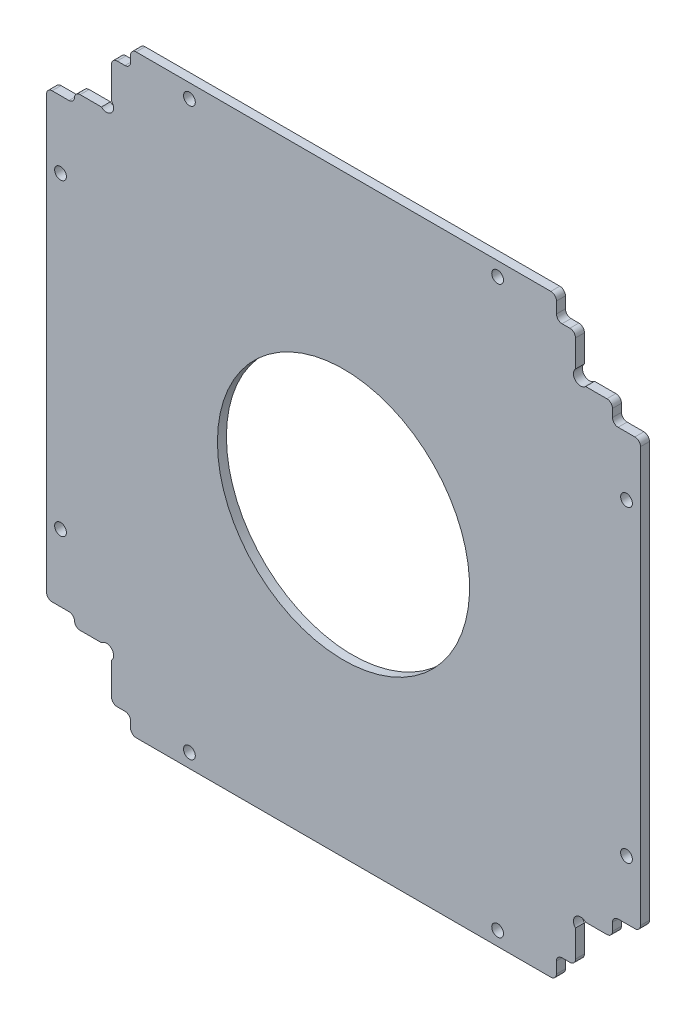
from build123d import *

# Parameters (mm, degrees)
SKETCH1_W               = 106
SKETCH1_H               = 106
MAINOUTLINE_DEPTH       = 1.6
RAILCUTOUTS_DEPTH       = 75.970394157
DOGBONES_DEPTH          = 75.970394157
SOLARFILLETS_DEPTH      = 75.970394157
HANDLINGFILLETS_R       = 1
M2_CLEARANCE_HOLE1_D    = 2.1
CUT_EXTRUDE2_DEPTH      = 75.9703943
CUT_EXTRUDE2_DEPTH_BACK = 75.9703943
SKETCH11_R              = 22.5


with BuildPart() as part:
    # Sketch1 → mainOutline (new body)
    with BuildSketch(Plane.XY):
        Rectangle(SKETCH1_W, SKETCH1_H)
    extrude(amount=MAINOUTLINE_DEPTH)

    # Sketch4 → railCutouts (cut, through all)
    with BuildSketch(Plane(origin=(0, 0, 0), x_dir=(-1, 0, 0), z_dir=(0, 0, -1))):
        Polygon((-41.4, -41.4), (-48, -41.4), (-48, -39), (-49.9975, -39), (-60.106513243, -39), (-60.106513243, -61.452099286), (-39, -61.452099286), (-39, -49.9), (-39, -49), (-41.4, -49), align=None)
        Polygon((39, -56.27525328), (39, -49.9), (41.4, -49.9), (41.4, -41.4), (48, -41.4), (48, -40.5), (55.517672261, -40.5), (55.517672261, -56.27525328), align=None)
        Polygon((55.383846757, 40.5), (48, 40.5), (48, 41.4), (41.4, 41.4), (41.4, 49.9), (39, 49.9), (39, 57.687687567), (55.383846757, 57.687687567), align=None)
        Polygon((-39, 59.880423019), (-39, 49.9), (-39, 49), (-41.4, 49), (-41.4, 41.4), (-48, 41.4), (-48, 39), (-49.9975, 39), (-56.842822937, 39), (-56.842822937, 59.880423019), align=None)
    extrude(amount=-RAILCUTOUTS_DEPTH, mode=Mode.SUBTRACT)

    # Sketch5 → dogbones (cut, through all)
    with BuildSketch(Plane(origin=(0, 0, 0), x_dir=(-1, 0, 0), z_dir=(0, 0, -1))):
        with BuildLine():
            Line((-41.4, -43.196051224), (-44.546497129, -46.342548353))
            ThreePointArc((-44.546497129, -46.342548353), (-46.342548353, -46.342548353), (-46.342548353, -44.546497129))
            Line((-46.342548353, -44.546497129), (-43.196051224, -41.4))
            ThreePointArc((-43.196051224, -41.4), (-41.4, -41.4), (-41.4, -43.196051224))
        make_face()
        with BuildLine():
            Line((43.196051224, -41.4), (44.93821772, -43.142166495))
            ThreePointArc((44.93821772, -43.142166495), (44.93821772, -44.93821772), (43.142166495, -44.93821772))
            Line((43.142166495, -44.93821772), (41.4, -43.196051224))
            ThreePointArc((41.4, -43.196051224), (41.4, -41.4), (43.196051224, -41.4))
        make_face()
        with BuildLine():
            Line((41.4, 43.196051224), (43.13099025, 44.927041474))
            ThreePointArc((43.13099025, 44.927041474), (44.927041474, 44.927041474), (44.927041474, 43.13099025))
            Line((44.927041474, 43.13099025), (43.196051224, 41.4))
            ThreePointArc((43.196051224, 41.4), (41.4, 41.4), (41.4, 43.196051224))
        make_face()
        with BuildLine():
            Line((-43.196051224, 41.4), (-44.694846249, 42.898795025))
            ThreePointArc((-44.694846249, 42.898795025), (-44.694846249, 44.694846249), (-42.898795025, 44.694846249))
            Line((-42.898795025, 44.694846249), (-41.4, 43.196051224))
            ThreePointArc((-41.4, 43.196051224), (-41.4, 41.4), (-43.196051224, 41.4))
        make_face()
    extrude(amount=-DOGBONES_DEPTH, mode=Mode.SUBTRACT)

    # Sketch6 → solarFillets (cut, through all)
    with BuildSketch(Plane(origin=(0, 0, 0), x_dir=(-1, 0, 0), z_dir=(0, 0, -1))):
        with BuildLine():
            Line((-40, 50), (-40, 53))
            ThreePointArc((-40, 53), (-39, 54), (-38, 53))
            Line((-38, 53), (-38, 50))
            ThreePointArc((-38, 50), (-39, 49), (-40, 50))
        make_face()
        with BuildLine():
            Line((-49, 38), (-53, 38))
            ThreePointArc((-53, 38), (-54, 39), (-53, 40))
            Line((-53, 40), (-49, 40))
            ThreePointArc((-49, 40), (-48, 39), (-49, 38))
        make_face()
        with BuildLine():
            Line((-49, -40), (-55.214202913, -40))
            ThreePointArc((-55.214202913, -40), (-56.214202913, -39), (-55.214202913, -38))
            Line((-55.214202913, -38), (-49, -38))
            ThreePointArc((-49, -38), (-48, -39), (-49, -40))
        make_face()
        with BuildLine():
            Line((-38, -50), (-38, -53.916094318))
            ThreePointArc((-38, -53.916094318), (-39, -54.916094318), (-40, -53.916094318))
            Line((-40, -53.916094318), (-40, -50))
            ThreePointArc((-40, -50), (-39, -49), (-38, -50))
        make_face()
        with BuildLine():
            Line((40, -50.9), (40, -54.538013421))
            ThreePointArc((40, -54.538013421), (39, -55.538013421), (38, -54.538013421))
            Line((38, -54.538013421), (38, -50.9))
            ThreePointArc((38, -50.9), (39, -49.9), (40, -50.9))
        make_face()
        with BuildLine():
            Line((49, -39.5), (54.202622605, -39.5))
            ThreePointArc((54.202622605, -39.5), (55.202622605, -40.5), (54.202622605, -41.5))
            Line((54.202622605, -41.5), (49, -41.5))
            ThreePointArc((49, -41.5), (48, -40.5), (49, -39.5))
        make_face()
        with BuildLine():
            Line((49, 41.5), (54.556563772, 41.5))
            ThreePointArc((54.556563772, 41.5), (55.556563772, 40.5), (54.556563772, 39.5))
            Line((54.556563772, 39.5), (49, 39.5))
            ThreePointArc((49, 39.5), (48, 40.5), (49, 41.5))
        make_face()
        with BuildLine():
            Line((38, 50.9), (38, 55.828092709))
            ThreePointArc((38, 55.828092709), (39, 56.828092709), (40, 55.828092709))
            Line((40, 55.828092709), (40, 50.9))
            ThreePointArc((40, 50.9), (39, 49.9), (38, 50.9))
        make_face()
    extrude(amount=-SOLARFILLETS_DEPTH, mode=Mode.SUBTRACT)

    # handlingFillets
    handlingfillets_edges = [part.edges().sort_by_distance(p)[0] for p in [
        (-41.4, -49.9, 0.8),
        (-38, -53, 0.8),
        (-53, -39.5, 0.8),
        (-48, -41.4, 0.8),
        (-48, 41.4, 0.8),
        (-53, 39.5, 0.8),
        (-41.4, 49.9, 0.8),
        (-38, 53, 0.8),
        (38, 53, 0.8),
        (41.4, 49, 0.8),
        (48, 41.4, 0.8),
        (53, 38, 0.8),
        (53, -38, 0.8),
        (48, -41.4, 0.8),
        (41.4, -49, 0.8),
        (38, -53, 0.8),
    ]]
    fillet(handlingfillets_edges, radius=HANDLINGFILLETS_R)

    # M2 Clearance Hole1 (through all)
    with Locations(Plane(origin=(0, 0, 0), x_dir=(-1, 0, 0), z_dir=(0, 0, -1))):
        with Locations((50.5, -27.5), (27.5, -50.5), (-50.5, -27.5), (-27.5, -50.5), (-27.5, 50.5), (-50.5, 27.5), (27.5, 50.5), (50.5, 27.5)):
            Hole(M2_CLEARANCE_HOLE1_D / 2)

    # Sketch11 → Cut-Extrude2 (cut, two sides: drawn at the far end of the back side and taken through both)
    with BuildSketch(Plane(origin=(0, 0, 0), x_dir=(-1, 0, 0), z_dir=(0, 0, -1)).offset(-CUT_EXTRUDE2_DEPTH_BACK)):
        Circle(SKETCH11_R)
    extrude(amount=CUT_EXTRUDE2_DEPTH + CUT_EXTRUDE2_DEPTH_BACK, mode=Mode.SUBTRACT)


solid = part.part
